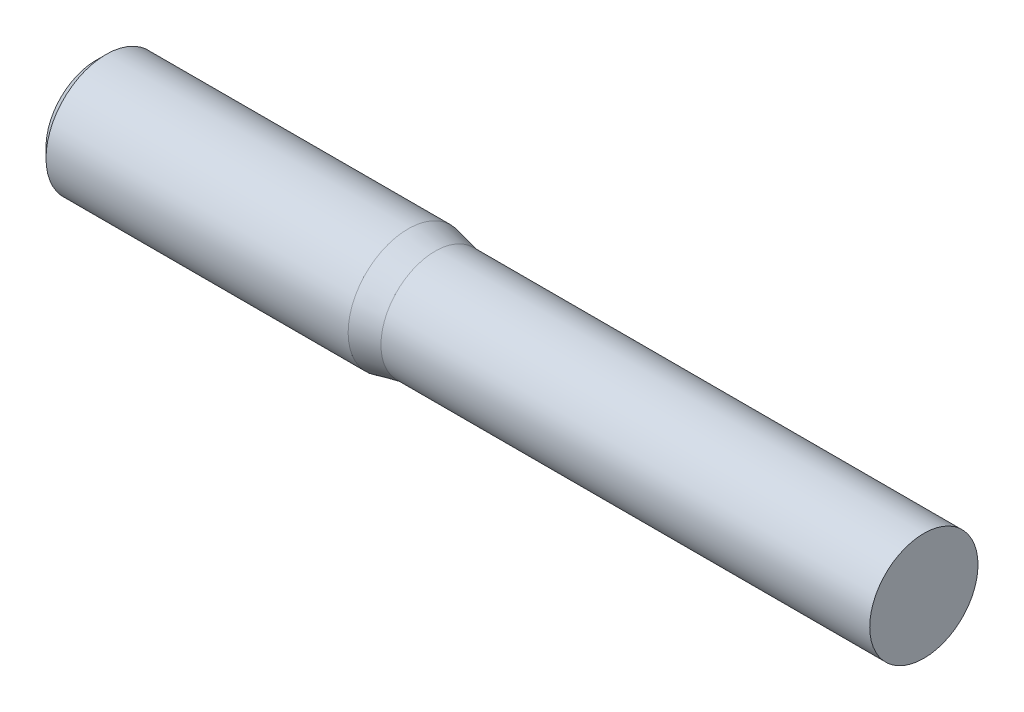
from build123d import *

# Parameters (mm, degrees)
HEADCHAMFER_SIZE = 0.812
BASEEND_START    = 4
SKETCH2_R        = 4.513
BASEEND_DEPTH    = 4


with BuildPart() as part:
    # Sketch1 → Base (revolve)
    with BuildSketch(Plane.XY):
        Polygon((0, 0), (0, 5), (26, 5), (28.25, 4.513), (65, 4.513), (65, 0), align=None)
    revolve(axis=Axis((0, 0, 0), (1, 0, 0)))

    # HeadChamfer
    headchamfer_edges = [part.edges().sort_by_distance(p)[0] for p in [
        (0, -5, 0),
    ]]
    chamfer(headchamfer_edges, length=HEADCHAMFER_SIZE)

    # Sketch2 → BaseEnd (add)
    with BuildSketch(Plane(origin=(65, 0, 0), x_dir=(0, 0, -1), z_dir=(1, 0, 0)).offset(BASEEND_START)):
        Circle(SKETCH2_R)
    extrude(amount=-BASEEND_DEPTH)


solid = part.part
